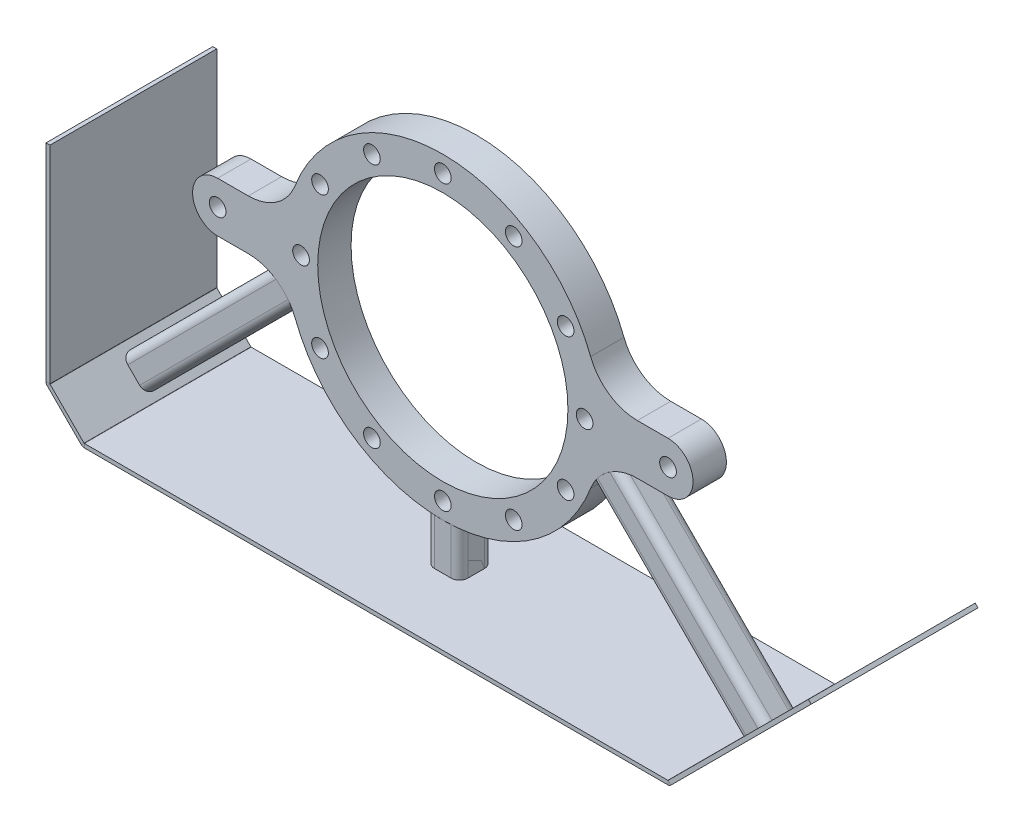
from build123d import *

# Parameters (mm, degrees)
SKETCH1_R                        = 190.5
SKETCH1_R_2                      = 12.7
BOSS_EXTRUDE1_DEPTH              = 50.8
FILLET2_R                        = 76.2
SKETCH6_W                        = 889
SKETCH6_H                        = 254
BASE_FLANGE2_DEPTH               = 6
EDGE_FLANGE1_STRIP_CUT_DEPTH     = 254
EDGE_FLANGE1_DEPTH               = 254
EDGE_FLANGE2_STRIP_CUT_DEPTH     = 254
EDGE_FLANGE2_DEPTH               = 254
EDGE_FLANGE3_STRIP_CUT_DEPTH     = 254
EDGE_FLANGE3_DEPTH               = 254
TUBE_SQUARE_TS2X2X0_25_7_DEPTH   = 396.316419115
TUBE_SQUARE_TS2X2X0_25_7_2_DEPTH = 311.5
TUBE_SQUARE_TS2X2X0_25_7_3_DEPTH = 396.316419115
SPLIT1_START                     = -50.8
SPLIT1_DEPTH                     = 50.8
SPLIT1_START_2                   = -219.337476388
SPLIT1_2_DEPTH                   = 81.081168926
SPLIT1_START_3                   = -52
SPLIT1_3_DEPTH                   = 53
SPLIT2_START                     = -311.5
SPLIT2_DEPTH                     = 71.540565928
SPLIT2_START_2                   = -52
SPLIT2_2_DEPTH                   = 53
SPLIT2_START_3                   = -50.8
SPLIT2_3_DEPTH                   = 50.8
SPLIT3_START                     = -50.8
SPLIT3_DEPTH                     = 50.8
SPLIT3_START_2                   = 138.256307462
SPLIT3_2_DEPTH                   = 81.081168824
SPLIT3_START_3                   = -52
SPLIT3_3_DEPTH                   = 53


with BuildPart() as part:
    # Sketch1 → Boss-Extrude1 (new body)
    with BuildSketch(Plane.XY):
        with BuildLine():
            Line((-342.9, -38.1), (-238.273120599, -38.1))
            ThreePointArc((-238.273120599, -38.1), (0, -241.3), (238.273120599, -38.1))
            Line((238.273120599, -38.1), (342.9, -38.1))
            ThreePointArc((342.9, -38.1), (381, 0), (342.9, 38.1))
            Line((342.9, 38.1), (238.273120599, 38.1))
            ThreePointArc((238.273120599, 38.1), (0, 241.3), (-238.273120599, 38.1))
            Line((-238.273120599, 38.1), (-342.9, 38.1))
            ThreePointArc((-342.9, 38.1), (-381, 0), (-342.9, -38.1))
        make_face()
        Circle(SKETCH1_R, mode=Mode.SUBTRACT)
        with Locations((0, 215.9)):
            Circle(SKETCH1_R_2, mode=Mode.SUBTRACT)
        with Locations((107.95, 186.974884677)):
            Circle(SKETCH1_R_2, mode=Mode.SUBTRACT)
        with Locations((186.974884677, 107.95)):
            Circle(SKETCH1_R_2, mode=Mode.SUBTRACT)
        with Locations((215.9, 0)):
            Circle(SKETCH1_R_2, mode=Mode.SUBTRACT)
        with Locations((186.974884677, -107.95)):
            Circle(SKETCH1_R_2, mode=Mode.SUBTRACT)
        with Locations((107.95, -186.974884677)):
            Circle(SKETCH1_R_2, mode=Mode.SUBTRACT)
        with Locations((0, -215.9)):
            Circle(SKETCH1_R_2, mode=Mode.SUBTRACT)
        with Locations((-107.95, -186.974884677)):
            Circle(SKETCH1_R_2, mode=Mode.SUBTRACT)
        with Locations((-186.974884677, -107.95)):
            Circle(SKETCH1_R_2, mode=Mode.SUBTRACT)
        with Locations((-215.9, 0)):
            Circle(SKETCH1_R_2, mode=Mode.SUBTRACT)
        with Locations((-186.974884677, 107.95)):
            Circle(SKETCH1_R_2, mode=Mode.SUBTRACT)
        with Locations((-107.95, 186.974884677)):
            Circle(SKETCH1_R_2, mode=Mode.SUBTRACT)
        with Locations((-342.9, 0)):
            Circle(SKETCH1_R_2, mode=Mode.SUBTRACT)
        with Locations(Location((342.9, 0, 0), (0, 0, 180))):
            Circle(SKETCH1_R_2, mode=Mode.SUBTRACT)
    extrude(amount=-BOSS_EXTRUDE1_DEPTH)

    # Fillet2
    fillet2_edges = [part.edges().sort_by_distance(p)[0] for p in [
        (-238.273120599, 38.1, -25.4),
        (238.273120599, 38.1, -25.4),
        (238.273120599, -38.1, -25.4),
        (-238.273120599, -38.1, -25.4),
    ]]
    fillet(fillet2_edges, radius=FILLET2_R)


with BuildPart() as body_2:
    # Base-Flange2: sheet metal written as solids
    # Sketch6 → Base-Flange2 (new body)
    with BuildSketch(Plane(origin=(0, -317.5, 0), x_dir=(1, 0, 0), z_dir=(0, 1, 0))):
        with Locations((0, 25.4)):
            Rectangle(SKETCH6_W, SKETCH6_H)
    extrude(amount=BASE_FLANGE2_DEPTH)

    # Edge-Flange1: sheet metal written as solids
    # Edge-Flange1 strip (on a plane across the edge) → Edge-Flange1 strip cut (cut)
    with BuildSketch(Plane(origin=(-444.5, -311.5, -152.4), x_dir=(0.7071067811865438, 0.7071067811865512, 0), z_dir=(0, 0, 1))):
        Polygon((-22.039168001, 13.553886626), (-4.026895542, -4.458385832), (0.215745145, -0.215745145), (-17.796527314, 17.796527314), align=None)
    extrude(amount=EDGE_FLANGE1_STRIP_CUT_DEPTH, mode=Mode.SUBTRACT)

    # Edge-Flange1 section (on a plane across the edge) → Edge-Flange1 (add)
    with BuildSketch(Plane(origin=(-444.5, -311.5, -152.4), x_dir=(0.7071067811865438, 0.7071067811865512, 0), z_dir=(0, 0, 1))):
        with BuildLine():
            Line((-6, 0.30510971), (-6, 73.714718626))
            Line((-6, 73.714718626), (0, 73.714718626))
            Line((0, 73.714718626), (0, 0.30510971))
            ThreePointArc((0, 0.30510971), (0.056070336, 0.023225094), (0.215745145, -0.215745145))
            Line((0.215745145, -0.215745145), (-4.026895542, -4.458385832))
            ThreePointArc((-4.026895542, -4.458385832), (-5.487206859, -2.2728755), (-6, 0.30510971))
        make_face()
    extrude(amount=EDGE_FLANGE1_DEPTH)

    # Edge-Flange2: sheet metal written as solids
    # Edge-Flange2 strip (on a plane across the edge) → Edge-Flange2 strip cut (cut)
    with BuildSketch(Plane(origin=(444.5, -311.5, 101.6), x_dir=(-0.7071067811865438, 0.7071067811865512, 0), z_dir=(0, 0, -1))):
        Polygon((-22.039168001, 13.553886626), (-4.026895542, -4.458385832), (0.215745145, -0.215745145), (-17.796527314, 17.796527314), align=None)
    extrude(amount=EDGE_FLANGE2_STRIP_CUT_DEPTH, mode=Mode.SUBTRACT)

    # Edge-Flange2 section (on a plane across the edge) → Edge-Flange2 (add)
    with BuildSketch(Plane(origin=(444.5, -311.5, 101.6), x_dir=(-0.7071067811865438, 0.7071067811865512, 0), z_dir=(0, 0, -1))):
        with BuildLine():
            Line((-6, 0.30510971), (-6, 302.314718626))
            Line((-6, 302.314718626), (0, 302.314718626))
            Line((0, 302.314718626), (0, 0.30510971))
            ThreePointArc((0, 0.30510971), (0.056070336, 0.023225094), (0.215745145, -0.215745145))
            Line((0.215745145, -0.215745145), (-4.026895542, -4.458385832))
            ThreePointArc((-4.026895542, -4.458385832), (-5.487206859, -2.2728755), (-6, 0.30510971))
        make_face()
    extrude(amount=EDGE_FLANGE2_DEPTH)

    # Edge-Flange3: sheet metal written as solids
    # Edge-Flange3 strip (on a plane across the edge) → Edge-Flange3 strip cut (cut)
    with BuildSketch(Plane(origin=(-496.624177414, -259.375822586, -152.4), x_dir=(1, 0, 0), z_dir=(0, 0, 1))):
        Polygon((-22.039168001, 13.553886626), (-4.026895542, -4.458385832), (0.215745145, -0.215745145), (-17.796527314, 17.796527314), align=None)
    extrude(amount=EDGE_FLANGE3_STRIP_CUT_DEPTH, mode=Mode.SUBTRACT)

    # Edge-Flange3 section (on a plane across the edge) → Edge-Flange3 (add)
    with BuildSketch(Plane(origin=(-496.624177414, -259.375822586, -152.4), x_dir=(1, 0, 0), z_dir=(0, 0, 1))):
        with BuildLine():
            Line((-6, 0.30510971), (-6, 315.014718626))
            Line((-6, 315.014718626), (0, 315.014718626))
            Line((0, 315.014718626), (0, 0.30510971))
            ThreePointArc((0, 0.30510971), (0.056070336, 0.023225094), (0.215745145, -0.215745145))
            Line((0.215745145, -0.215745145), (-4.026895542, -4.458385832))
            ThreePointArc((-4.026895542, -4.458385832), (-5.487206859, -2.2728755), (-6, 0.30510971))
        make_face()
    extrude(amount=EDGE_FLANGE3_DEPTH)


with BuildPart() as body_3:
    # Sketch124 → Tube square TS2X2X0.25(7) (new body)
    with BuildSketch(Plane(origin=(-470.669961279, -285.330038721, -25.4), x_dir=(-0.7071067811865476, 0.7071067811865476, 0), z_dir=(0.7071067811865476, 0.7071067811865476, 0))):
        with BuildLine():
            Line((-12.7, -25.4), (12.7, -25.4))
            ThreePointArc((12.7, -25.4), (21.680256121, -21.680256121), (25.4, -12.7))
            Line((25.4, -12.7), (25.4, 12.7))
            ThreePointArc((25.4, 12.7), (21.680256121, 21.680256121), (12.7, 25.4))
            Line((12.7, 25.4), (-12.7, 25.4))
            ThreePointArc((-12.7, 25.4), (-21.680256121, 21.680256121), (-25.4, 12.7))
            Line((-25.4, 12.7), (-25.4, -12.7))
            ThreePointArc((-25.4, -12.7), (-21.680256121, -21.680256121), (-12.7, -25.4))
        make_face()
        with BuildLine():
            Line((-12.7, -19.05), (12.7, -19.05))
            ThreePointArc((12.7, -19.05), (17.190128061, -17.190128061), (19.05, -12.7))
            Line((19.05, -12.7), (19.05, 12.7))
            ThreePointArc((19.05, 12.7), (17.190128061, 17.190128061), (12.7, 19.05))
            Line((12.7, 19.05), (-12.7, 19.05))
            ThreePointArc((-12.7, 19.05), (-17.190128061, 17.190128061), (-19.05, 12.7))
            Line((-19.05, 12.7), (-19.05, -12.7))
            ThreePointArc((-19.05, -12.7), (-17.190128061, -17.190128061), (-12.7, -19.05))
        make_face(mode=Mode.SUBTRACT)
    extrude(amount=TUBE_SQUARE_TS2X2X0_25_7_DEPTH)

    # Split1: read off the stored shape, not the designer's step
    # Split1 outline → Split1 (cut)
    with BuildSketch(Plane.XY.offset(SPLIT1_START)):
        with BuildLine():
            Line((-228.591861423, -79.172963713), (-172.471421585, -23.052523511))
            Line((-172.471421585, -23.052523511), (-208.39244607, 12.868500973))
            Line((-208.39244607, 12.868500973), (-265.725490847, -44.464543122))
            ThreePointArc((-265.725490847, -44.464543122), (-244.179365295, -58.631266842), (-228.591861423, -79.172963713))
        make_face()
    extrude(amount=SPLIT1_DEPTH, mode=Mode.SUBTRACT)


with BuildPart() as body_4:
    # Sketch124 on segment 2 (carried to segment 2) → Tube square TS2X2X0.25_7 2 (new body)
    with BuildSketch(Plane(origin=(0, 0, -25.4), x_dir=(1, 0, 0), z_dir=(0, -1, 0))):
        with BuildLine():
            Line((-12.7, -25.4), (12.7, -25.4))
            ThreePointArc((12.7, -25.4), (21.680256121, -21.680256121), (25.4, -12.7))
            Line((25.4, -12.7), (25.4, 12.7))
            ThreePointArc((25.4, 12.7), (21.680256121, 21.680256121), (12.7, 25.4))
            Line((12.7, 25.4), (-12.7, 25.4))
            ThreePointArc((-12.7, 25.4), (-21.680256121, 21.680256121), (-25.4, 12.7))
            Line((-25.4, 12.7), (-25.4, -12.7))
            ThreePointArc((-25.4, -12.7), (-21.680256121, -21.680256121), (-12.7, -25.4))
        make_face()
        with BuildLine():
            Line((-12.7, -19.05), (12.7, -19.05))
            ThreePointArc((12.7, -19.05), (17.190128061, -17.190128061), (19.05, -12.7))
            Line((19.05, -12.7), (19.05, 12.7))
            ThreePointArc((19.05, 12.7), (17.190128061, 17.190128061), (12.7, 19.05))
            Line((12.7, 19.05), (-12.7, 19.05))
            ThreePointArc((-12.7, 19.05), (-17.190128061, 17.190128061), (-19.05, 12.7))
            Line((-19.05, 12.7), (-19.05, -12.7))
            ThreePointArc((-19.05, -12.7), (-17.190128061, -17.190128061), (-12.7, -19.05))
        make_face(mode=Mode.SUBTRACT)
    extrude(amount=TUBE_SQUARE_TS2X2X0_25_7_2_DEPTH)

    # Split2 3 outline → Split2 3 (cut)
    with BuildSketch(Plane.XY.offset(SPLIT2_START_3)):
        with BuildLine():
            Line((-25.400008525, -239.959433169), (-25.4, -311.5))
            Line((-25.4, -311.5), (25.4, -311.5))
            Line((25.4, -311.5), (25.400008525, -239.959433169))
            ThreePointArc((25.400008525, -239.959433169), (0, -241.3), (-25.400008525, -239.959433169))
        make_face()
    extrude(amount=SPLIT2_3_DEPTH, mode=Mode.SUBTRACT)


with BuildPart() as body_5:
    # Sketch124 on segment 3 (carried to segment 3) → Tube square TS2X2X0.25_7 3 (new body)
    with BuildSketch(Plane(origin=(470.669961279, -285.330038721, -25.4), x_dir=(-0.707106781, -0.707106781, 0), z_dir=(-0.707106781, 0.707106781, 0))):
        with BuildLine():
            Line((-12.7, -25.4), (12.7, -25.4))
            ThreePointArc((12.7, -25.4), (21.680256121, -21.680256121), (25.4, -12.7))
            Line((25.4, -12.7), (25.4, 12.7))
            ThreePointArc((25.4, 12.7), (21.680256121, 21.680256121), (12.7, 25.4))
            Line((12.7, 25.4), (-12.7, 25.4))
            ThreePointArc((-12.7, 25.4), (-21.680256121, 21.680256121), (-25.4, 12.7))
            Line((-25.4, 12.7), (-25.4, -12.7))
            ThreePointArc((-25.4, -12.7), (-21.680256121, -21.680256121), (-12.7, -25.4))
        make_face()
        with BuildLine():
            Line((-12.7, -19.05), (12.7, -19.05))
            ThreePointArc((12.7, -19.05), (17.190128061, -17.190128061), (19.05, -12.7))
            Line((19.05, -12.7), (19.05, 12.7))
            ThreePointArc((19.05, 12.7), (17.190128061, 17.190128061), (12.7, 19.05))
            Line((12.7, 19.05), (-12.7, 19.05))
            ThreePointArc((-12.7, 19.05), (-17.190128061, 17.190128061), (-19.05, 12.7))
            Line((-19.05, 12.7), (-19.05, -12.7))
            ThreePointArc((-19.05, -12.7), (-17.190128061, -17.190128061), (-12.7, -19.05))
        make_face(mode=Mode.SUBTRACT)
    extrude(amount=TUBE_SQUARE_TS2X2X0_25_7_3_DEPTH)

    # Split3: read off the stored shape, not the designer's step
    # Split3 outline → Split3 (cut)
    with BuildSketch(Plane.XY.offset(SPLIT3_START)):
        with BuildLine():
            Line((265.725490847, -44.464543122), (208.39244607, 12.868500973))
            Line((208.39244607, 12.868500973), (172.471421585, -23.052523511))
            Line((172.471421585, -23.052523511), (228.591861423, -79.172963713))
            ThreePointArc((228.591861423, -79.172963713), (244.179365295, -58.631266842), (265.725490847, -44.464543122))
        make_face()
    extrude(amount=SPLIT3_DEPTH, mode=Mode.SUBTRACT)


with BuildPart() as body_6:
    # Split1 2 outline → Split1 2 (new body)
    with BuildSketch(Plane(origin=(0, 0, 0), x_dir=(0.7071067811865474, -0.7071067811865477, 0), z_dir=(0.7071067811865476, 0.7071067811865476, 0)).offset(SPLIT1_START_2)):
        with BuildLine():
            Line((-143.755116066, 0), (-118.355116066, 0))
            ThreePointArc((-118.355116066, 0), (-109.374859945, 3.719743879), (-105.655116066, 12.7))
            Line((-105.655116066, 12.7), (-105.655116066, 38.1))
            ThreePointArc((-105.655116066, 38.1), (-109.374859945, 47.080256121), (-118.355116066, 50.8))
            Line((-118.355116066, 50.8), (-143.755116066, 50.8))
            ThreePointArc((-143.755116066, 50.8), (-152.735372187, 47.080256121), (-156.455116066, 38.1))
            Line((-156.455116066, 38.1), (-156.455116066, 12.7))
            ThreePointArc((-156.455116066, 12.7), (-152.735372187, 3.719743879), (-143.755116066, 0))
        make_face()
        with BuildLine():
            ThreePointArc((-112.005116066, 12.7), (-113.864988005, 8.209871939), (-118.355116066, 6.35))
            Line((-118.355116066, 6.35), (-143.755116066, 6.35))
            ThreePointArc((-143.755116066, 6.35), (-148.245244127, 8.20987194), (-150.105116066, 12.7))
            Line((-150.105116066, 12.7), (-150.105116066, 38.1))
            ThreePointArc((-150.105116066, 38.1), (-148.245244126, 42.59012806), (-143.755116066, 44.45))
            Line((-143.755116066, 44.45), (-118.355116066, 44.45))
            ThreePointArc((-118.355116066, 44.45), (-113.864988005, 42.590128061), (-112.005116066, 38.1))
            Line((-112.005116066, 38.1), (-112.005116066, 12.7))
        make_face(mode=Mode.SUBTRACT)
    extrude(amount=SPLIT1_2_DEPTH)

    # Split1 3 outline → Split1 3 (cut)
    with BuildSketch(Plane.XY.offset(SPLIT1_START_3)):
        with BuildLine():
            Line((-229.80446596, -80.385567885), (-228.591861485, -79.172963593))
            ThreePointArc((-228.591861485, -79.172963593), (-244.179365256, -58.631266878), (-265.725490627, -44.464543218))
            Line((-265.725490627, -44.464543218), (-229.80446596, -80.385567885))
        make_face()
    extrude(amount=SPLIT1_3_DEPTH, mode=Mode.SUBTRACT)


with BuildPart() as body_6_2:
    # Split2: read off the stored shape, not the designer's step
    # Split2 outline → Split2 (new body)
    with BuildSketch(Plane(origin=(0, 0, 0), x_dir=(1, 0, 0), z_dir=(0, 1, 0)).offset(SPLIT2_START)):
        with BuildLine():
            Line((-12.7, 0), (12.7, 0))
            ThreePointArc((12.7, 0), (21.680256121, 3.719743879), (25.4, 12.7))
            Line((25.4, 12.7), (25.4, 38.1))
            ThreePointArc((25.4, 38.1), (21.680256121, 47.080256121), (12.7, 50.8))
            Line((12.7, 50.8), (-12.7, 50.8))
            ThreePointArc((-12.7, 50.8), (-21.680256121, 47.080256121), (-25.4, 38.1))
            Line((-25.4, 38.1), (-25.4, 12.7))
            ThreePointArc((-25.4, 12.7), (-21.680256121, 3.719743879), (-12.7, 0))
        make_face()
        with BuildLine():
            ThreePointArc((19.05, 12.7), (17.190128061, 8.209871939), (12.7, 6.35))
            Line((12.7, 6.35), (-12.7, 6.35))
            ThreePointArc((-12.7, 6.35), (-17.190128061, 8.209871939), (-19.05, 12.7))
            Line((-19.05, 12.7), (-19.05, 38.1))
            ThreePointArc((-19.05, 38.1), (-17.190128061, 42.590128061), (-12.7, 44.45))
            Line((-12.7, 44.45), (12.7, 44.45))
            ThreePointArc((12.7, 44.45), (17.190128061, 42.590128061), (19.05, 38.1))
            Line((19.05, 38.1), (19.05, 12.7))
        make_face(mode=Mode.SUBTRACT)
    extrude(amount=SPLIT2_DEPTH)

    # Split2 2 outline → Split2 2 (cut)
    with BuildSketch(Plane.XY.offset(SPLIT2_START_2)):
        with BuildLine():
            Line((25.400008525, -239.959433169), (-25.400008525, -239.959433169))
            ThreePointArc((-25.400008525, -239.959433169), (0, -241.3), (25.400008525, -239.959433169))
        make_face()
    extrude(amount=SPLIT2_2_DEPTH, mode=Mode.SUBTRACT)


with BuildPart() as body_6_3:
    # Split3 2 outline → Split3 2 (new body)
    with BuildSketch(Plane(origin=(0, 0, 0), x_dir=(0.707106781186548, 0.707106781186547, 0), z_dir=(0.707106781186547, -0.707106781186548, 0)).offset(SPLIT3_START_2)):
        with BuildLine():
            Line((143.755116066, 0), (118.355116066, 0))
            ThreePointArc((118.355116066, 0), (109.374859945, -3.719743879), (105.655116066, -12.7))
            Line((105.655116066, -12.7), (105.655116066, -38.1))
            ThreePointArc((105.655116066, -38.1), (109.374859945, -47.080256121), (118.355116066, -50.8))
            Line((118.355116066, -50.8), (143.755116066, -50.8))
            ThreePointArc((143.755116066, -50.8), (152.735372187, -47.080256121), (156.455116066, -38.1))
            Line((156.455116066, -38.1), (156.455116066, -12.7))
            ThreePointArc((156.455116066, -12.7), (152.735372187, -3.719743879), (143.755116066, 0))
        make_face()
        with BuildLine():
            ThreePointArc((112.005116066, -12.7), (113.864988005, -8.209871939), (118.355116066, -6.35))
            Line((118.355116066, -6.35), (143.755116066, -6.35))
            ThreePointArc((143.755116066, -6.35), (148.245244126, -8.20987194), (150.105116066, -12.7))
            Line((150.105116066, -12.7), (150.105116066, -38.1))
            ThreePointArc((150.105116066, -38.1), (148.245244126, -42.59012806), (143.755116066, -44.45))
            Line((143.755116066, -44.45), (118.355116066, -44.45))
            ThreePointArc((118.355116066, -44.45), (113.864988005, -42.590128061), (112.005116066, -38.1))
            Line((112.005116066, -38.1), (112.005116066, -12.7))
        make_face(mode=Mode.SUBTRACT)
    extrude(amount=SPLIT3_2_DEPTH)

    # Split3 3 outline → Split3 3 (cut)
    with BuildSketch(Plane.XY.offset(SPLIT3_START_3)):
        with BuildLine():
            ThreePointArc((265.72549061, -44.464543226), (244.179365249, -58.631266885), (228.591861485, -79.172963593))
            Line((228.591861485, -79.172963593), (229.804465887, -80.385567813))
            Line((229.804465887, -80.385567813), (265.72549061, -44.464543226))
        make_face()
    extrude(amount=SPLIT3_3_DEPTH, mode=Mode.SUBTRACT)


solid = Compound([part.part, body_2.part, body_3.part, body_5.part, body_6_2.part])
